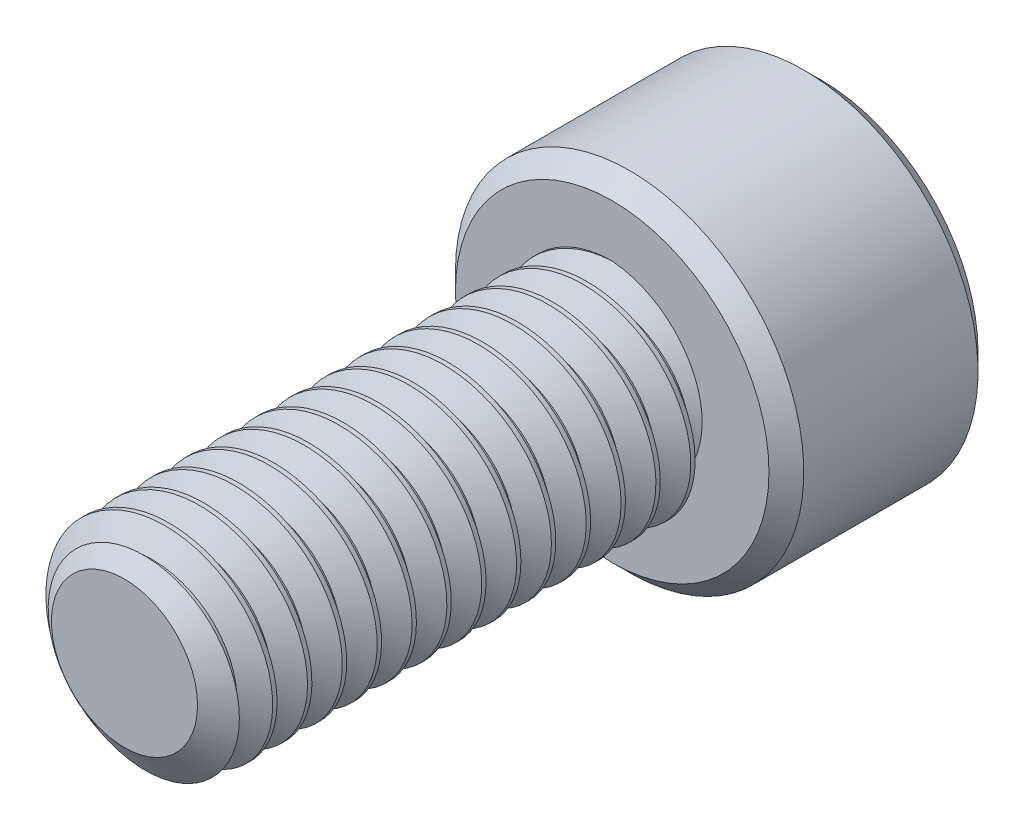
from build123d import *

# Parameters (mm, degrees)
SKETCH1_R          = 3
EXTRUDE1_DEPTH     = 14
CUT_SWEEP1_PITCH   = 1
SKETCH6_R          = 5
EXTRUDE2_DEPTH     = 6
CUT_EXTRUDE1_DEPTH = 3.75
CHAMFER1_SIZE      = 0.5


with BuildPart() as part:
    # Sketch1 → Extrude1 (new body)
    with BuildSketch(Plane.XY):
        Circle(SKETCH1_R)
    extrude(amount=-EXTRUDE1_DEPTH)

    # Cut-Sweep1: the profile of Sketch3 profile screwed along a right-hand helix of 15 turns, 6 arcs to a turn; built about Z, then put on its axis
    cut_sweep1_z = Axis((0, 0, 0), (0, 0, 1))
    cut_sweep1_corners = [(3.0003, 0, -0.875173205), (2.350480947, 0, -0.5), (2.350480947, 0, -0.375), (3.0003, 0, 0.000173205)]
    with BuildLine(mode=Mode.PRIVATE) as cut_sweep1_profile:
        Line(cut_sweep1_corners[0], cut_sweep1_corners[1])
        Line(cut_sweep1_corners[1], cut_sweep1_corners[2])
        Line(cut_sweep1_corners[2], cut_sweep1_corners[3])
        Line(cut_sweep1_corners[3], cut_sweep1_corners[0])
    cut_sweep1_cap = Face(cut_sweep1_profile.wire())
    cut_sweep1_turn_angles = [0, 30, 60, 90, 120, 150, 180, 210, 240, 270, 300, 330, 360]
    cut_sweep1_turn_weights = [1, 0.8660254037844387, 1, 0.8660254037844387, 1, 0.8660254037844387, 1, 0.8660254037844387, 1, 0.8660254037844387, 1, 0.8660254037844387, 1]
    cut_sweep1_turn_rails = [Edge.make_bspline([Vector(p[0], p[1], 0).rotate(cut_sweep1_z, cut_sweep1_turn_angles[k]) / cut_sweep1_turn_weights[k] + Vector(0, 0, p[2] + CUT_SWEEP1_PITCH * cut_sweep1_turn_angles[k] / 360) for k in range(13)], [0, 0, 0, 1, 1, 2, 2, 3, 3, 4, 4, 5, 5, 6, 6, 6], 2, cut_sweep1_turn_weights) for p in cut_sweep1_corners]
    cut_sweep1_turn_sides = [Face.make_surface_from_curves(cut_sweep1_turn_rails[p[0]], cut_sweep1_turn_rails[p[1]]) for p in [(0, 1), (1, 2), (2, 3), (3, 0)]]
    cut_sweep1 = Plane(origin=(0, 0, 0), x_dir=(0, 1, 0), z_dir=(0, 0, -1)) * Solid(Shell([*[p.moved(Location((0, 0, CUT_SWEEP1_PITCH * i))) for i in range(15) for p in cut_sweep1_turn_sides], cut_sweep1_cap, cut_sweep1_cap.rotate(cut_sweep1_z, 5400).moved(Location((0, 0, CUT_SWEEP1_PITCH * 5400 / 360)))]))
    add(cut_sweep1, mode=Mode.SUBTRACT)

    # Sketch4 → Cut-Revolve1 (revolve, cut)
    with BuildSketch(Plane(origin=(0, 0, 0), x_dir=(0, 0, -1), z_dir=(1, 0, 0)), mode=Mode.PRIVATE) as cut_revolve1_sk:
        Polygon((0.632650852, 3), (0, 2.096480947), (0, 3), align=None)
    revolve(cut_revolve1_sk.sketch.rotate(Axis((0, 0, 0), (0, 0, -1)), 244.349292568), axis=Axis((0, 0, 0), (0, 0, -1)), mode=Mode.SUBTRACT)

    # Sketch6 → Extrude2 (add)
    with BuildSketch(Plane(origin=(0, 0, -14), x_dir=(-1, 0, 0), z_dir=(0, 0, -1))):
        Circle(SKETCH6_R)
    extrude(amount=EXTRUDE2_DEPTH)

    # Sketch7 → Cut-Extrude1 (cut)
    with BuildSketch(Plane(origin=(0, 0, -20), x_dir=(-1, 0, 0), z_dir=(0, 0, -1))):
        Polygon((0, 2.886751346), (-2.5, 1.443375673), (-2.5, -1.443375673), (0, -2.886751346), (2.5, -1.443375673), (2.5, 1.443375673), align=None)
    extrude(amount=-CUT_EXTRUDE1_DEPTH, mode=Mode.SUBTRACT)

    # Cut-Extrude2 cone 1 section (through the dimple's axis) → Cut-Extrude2 (revolve, cut)
    with BuildSketch(Plane(origin=(0, 0, -20), x_dir=(0, 1, 0), z_dir=(1, 0, 0))):
        Polygon((0, 0), (2.886751346, 0), (0, 2.886751346), align=None)
    revolve(axis=Axis((0, 0, -20), (0, 0, 1)), mode=Mode.SUBTRACT)

    # Chamfer1
    chamfer1_edges = [part.edges().sort_by_distance(p)[0] for p in [
        (5, 0, -14),
        (5, 0, -20),
    ]]
    chamfer(chamfer1_edges, length=CHAMFER1_SIZE)


solid = part.part
